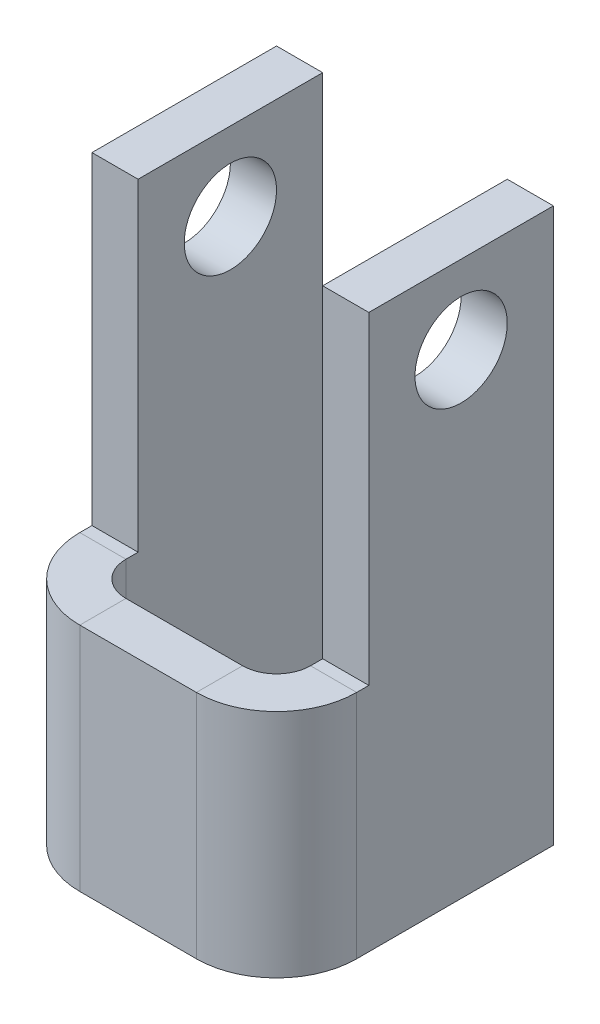
from build123d import *

# Parameters (mm, degrees)
CROQUIS2_W                         = 6
CROQUIS2_H                         = 12
BRIDA_BASE1_DEPTH                  = 1
BRIDA_DE_ARISTA1_STRIP_W           = 5.4732
BRIDA_DE_ARISTA1_STRIP_H           = 1
BRIDA_DE_ARISTA1_STRIP_CUT_DEPTH   = 12
BRIDA_DE_ARISTA1_STRIP_2_W         = 5.4732
BRIDA_DE_ARISTA1_STRIP_2_H         = 1
BRIDA_DE_ARISTA1_STRIP_CUT_2_DEPTH = 12
BRIDA_DE_ARISTA1_DEPTH             = 12
BRIDA_DE_ARISTA1_BEND_DEPTH        = 12
CROQUIS13_W                        = 2
CROQUIS13_H                        = 7
CORTAR_EXTRUIR1_DEPTH              = 10
CORTAR_EXTRUIR2_REACH              = 16.697
CROQUIS14_R                        = 1


# Sheet-metal steps are written as plain solids
with BuildPart() as part:
    # Croquis2 → Brida base1 (new body)
    with BuildSketch(Plane.XY):
        with Locations((3, 6)):
            Rectangle(CROQUIS2_W, CROQUIS2_H)
    extrude(amount=-BRIDA_BASE1_DEPTH)

    # Brida de arista1 strip (across the edge) → Brida de arista1 strip cut (cut)
    with BuildSketch(Plane(origin=(6, 12, -1), x_dir=(-1, 0, 0), z_dir=(0, -1, 0))):
        with Locations((-1, -0.5)):
            Rectangle(BRIDA_DE_ARISTA1_STRIP_W, BRIDA_DE_ARISTA1_STRIP_H)
    extrude(amount=BRIDA_DE_ARISTA1_STRIP_CUT_DEPTH, mode=Mode.SUBTRACT)

    # Brida de arista1 strip 2 (across the edge) → Brida de arista1 strip cut 2 (cut)
    with BuildSketch(Plane(origin=(0, 0, -1), x_dir=(1, 0, 0), z_dir=(0, 1, 0))):
        with Locations((-1, -0.5)):
            Rectangle(BRIDA_DE_ARISTA1_STRIP_2_W, BRIDA_DE_ARISTA1_STRIP_2_H)
    extrude(amount=BRIDA_DE_ARISTA1_STRIP_CUT_2_DEPTH, mode=Mode.SUBTRACT)

    # Brida de arista1 section (across the edge) → Brida de arista1 (add)
    with BuildSketch(Plane(origin=(6, 12, -1), x_dir=(-1, 0, 0), z_dir=(0, -1, 0))):
        with BuildLine():
            Line((0, 0.7366), (0, 5))
            Line((0, 5), (1, 5))
            Line((1, 5), (1, 0.7366))
            ThreePointArc((1, 0.7366), (1.215745145, 0.215745145), (1.7366, 0))
            Line((1.7366, 0), (1.7366, -1))
            ThreePointArc((1.7366, -1), (0.508638364, -0.491361636), (0, 0.7366))
        make_face()
    extrude(amount=BRIDA_DE_ARISTA1_DEPTH)

    # Brida de arista1 section 2 (across the edge) → Brida de arista1 bend (add)
    with BuildSketch(Plane(origin=(0, 0, -1), x_dir=(1, 0, 0), z_dir=(0, 1, 0))):
        with BuildLine():
            Line((0, 0.7366), (0, 5))
            Line((0, 5), (1, 5))
            Line((1, 5), (1, 0.7366))
            ThreePointArc((1, 0.7366), (1.215745145, 0.215745145), (1.7366, 0))
            Line((1.7366, 0), (1.7366, -1))
            ThreePointArc((1.7366, -1), (0.508638364, -0.491361636), (0, 0.7366))
        make_face()
    extrude(amount=BRIDA_DE_ARISTA1_BEND_DEPTH)

    # Croquis13 → Cortar-Extruir1 (cut)
    with BuildSketch(Plane(origin=(6, 0, 0), x_dir=(0, 0, -1), z_dir=(1, 0, 0))):
        with Locations((1, 8.5)):
            Rectangle(CROQUIS13_W, CROQUIS13_H)
    extrude(amount=-CORTAR_EXTRUIR1_DEPTH, mode=Mode.SUBTRACT)

    # Cortar-Extruir2: up to this face of the body (flat: up to its plane)
    cortar_extruir2_end = Plane(part.part.faces().sort_by_distance((0, 5.906533244, -3.943073405))[0])
    # Croquis14 → Cortar-Extruir2 (cut, up to the picked face)
    with BuildSketch(Plane(origin=(6, 0, 0), x_dir=(0, 0, -1), z_dir=(1, 0, 0)), mode=Mode.PRIVATE) as cortar_extruir2_sk1:
        with Locations((4, 10.3)):
            Circle(CROQUIS14_R)
    cortar_extruir2_tool1 = split(extrude(cortar_extruir2_sk1.sketch, amount=-CORTAR_EXTRUIR2_REACH, mode=Mode.PRIVATE), bisect_by=cortar_extruir2_end, keep=Keep.BOTH, mode=Mode.PRIVATE)
    add(cortar_extruir2_tool1.solids().sort_by(Axis((6, 10.3, -4), (-1, 0, 0)))[0], mode=Mode.SUBTRACT)


solid = part.part
